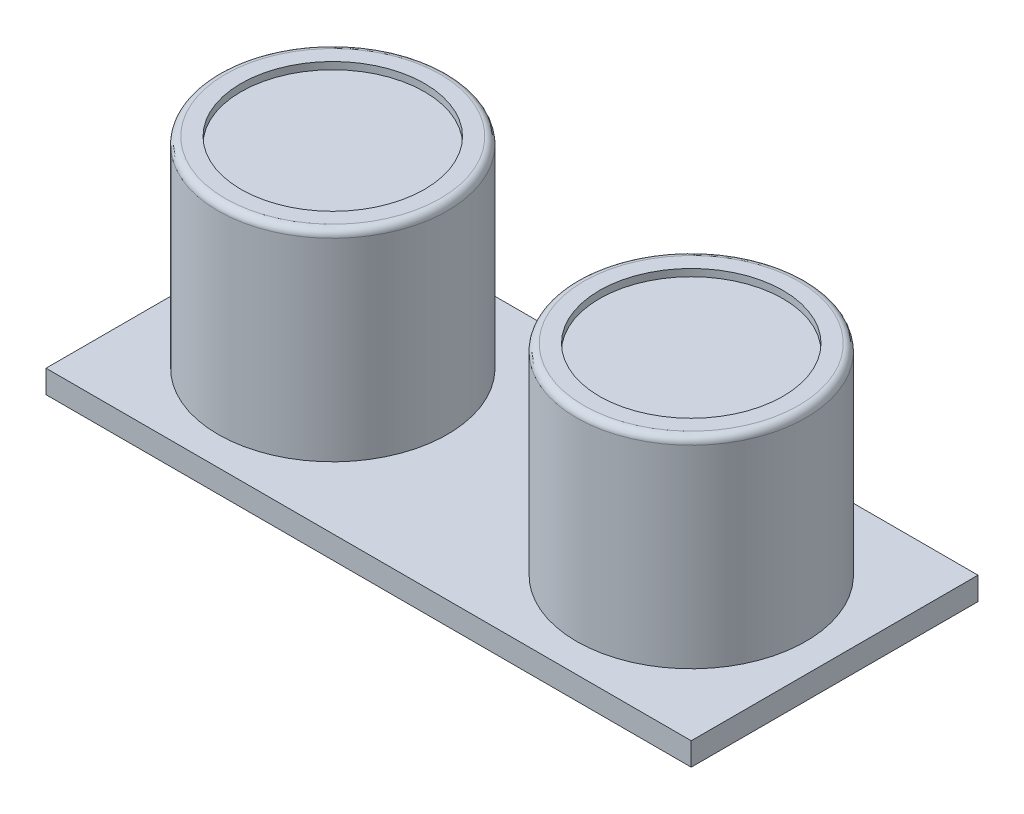
from build123d import *

# Parameters (mm, degrees)
SKETCH1_W           = 45
SKETCH1_H           = 20
BOSS_EXTRUDE1_DEPTH = 1.6
SKETCH2_R           = 8
BOSS_EXTRUDE2_DEPTH = 14
SKETCH3_R           = 6.4
CUT_EXTRUDE1_DEPTH  = 0.5
FILLET1_R           = 0.5


with BuildPart() as part:
    # Sketch1 → Boss-Extrude1 (new body)
    with BuildSketch(Plane(origin=(0, 0, 0), x_dir=(1, 0, 0), z_dir=(0, 1, 0))):
        with Locations((22.5, 10)):
            Rectangle(SKETCH1_W, SKETCH1_H)
    extrude(amount=BOSS_EXTRUDE1_DEPTH)

    # Sketch2 → Boss-Extrude2 (add)
    with BuildSketch(Plane(origin=(0, 1.6, 0), x_dir=(1, 0, 0), z_dir=(0, 1, 0))):
        with Locations((10, 10)):
            Circle(SKETCH2_R)
        with Locations((35, 10)):
            Circle(SKETCH2_R)
    extrude(amount=BOSS_EXTRUDE2_DEPTH)

    # Sketch3 → Cut-Extrude1 (cut)
    with BuildSketch(Plane(origin=(0, 15.6, 0), x_dir=(1, 0, 0), z_dir=(0, 1, 0))):
        with Locations((10, 10)):
            Circle(SKETCH3_R)
        with Locations((35, 10)):
            Circle(SKETCH3_R)
    extrude(amount=-CUT_EXTRUDE1_DEPTH, mode=Mode.SUBTRACT)

    # Fillet1
    fillet1_edges = [part.edges().sort_by_distance(p)[0] for p in [
        (27, 15.6, -10),
        (2, 15.6, -10),
    ]]
    fillet(fillet1_edges, radius=FILLET1_R)


solid = part.part
